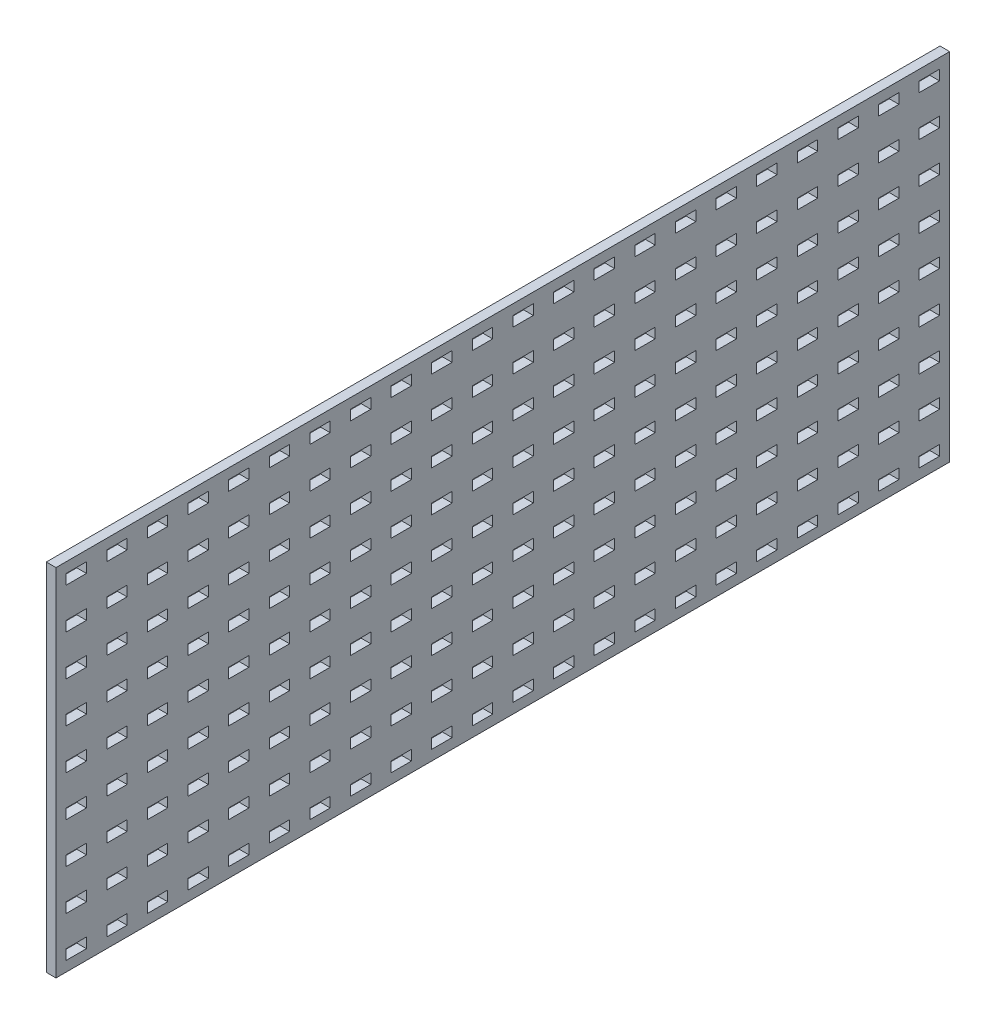
from build123d import *

# Parameters (mm, degrees)
SKETCH1_W           = 558.8
SKETCH1_H           = 222.25
BOSS_EXTRUDE1_DEPTH = 3.0226
SKETCH2_W           = 12.7
SKETCH2_H           = 6.35
CUT_EXTRUDE1_DEPTH  = 301.748516319


with BuildPart() as part:
    # Sketch1 → Boss-Extrude1 (new, symmetric)
    with BuildSketch(Plane(origin=(0, 0, 0), x_dir=(0, 0, -1), z_dir=(1, 0, 0))):
        Rectangle(SKETCH1_W, SKETCH1_H)
    extrude(amount=BOSS_EXTRUDE1_DEPTH, both=True)

    # Sketch2 → Cut-Extrude1 (cut, through all)
    with BuildSketch(Plane(origin=(3.0226, 0, 0), x_dir=(0, 0, -1), z_dir=(1, 0, 0))):
        with Locations((266.7, -101.6)):
            Rectangle(SKETCH2_W, SKETCH2_H)
        with Locations((241.3, -101.6)):
            Rectangle(SKETCH2_W, SKETCH2_H)
        with Locations((215.9, -101.6)):
            Rectangle(SKETCH2_W, SKETCH2_H)
        with Locations((190.5, -101.6)):
            Rectangle(SKETCH2_W, SKETCH2_H)
        with Locations((165.1, -101.6)):
            Rectangle(SKETCH2_W, SKETCH2_H)
        with Locations((139.7, -101.6)):
            Rectangle(SKETCH2_W, SKETCH2_H)
        with Locations((114.3, -101.6)):
            Rectangle(SKETCH2_W, SKETCH2_H)
        with Locations((88.9, -101.6)):
            Rectangle(SKETCH2_W, SKETCH2_H)
        with Locations((63.5, -101.6)):
            Rectangle(SKETCH2_W, SKETCH2_H)
        with Locations((38.1, -101.6)):
            Rectangle(SKETCH2_W, SKETCH2_H)
        with Locations((12.7, -101.6)):
            Rectangle(SKETCH2_W, SKETCH2_H)
        with Locations((-12.7, -101.6)):
            Rectangle(SKETCH2_W, SKETCH2_H)
        with Locations((-38.1, -101.6)):
            Rectangle(SKETCH2_W, SKETCH2_H)
        with Locations((-63.5, -101.6)):
            Rectangle(SKETCH2_W, SKETCH2_H)
        with Locations((-88.9, -101.6)):
            Rectangle(SKETCH2_W, SKETCH2_H)
        with Locations((-114.3, -101.6)):
            Rectangle(SKETCH2_W, SKETCH2_H)
        with Locations((-139.7, -101.6)):
            Rectangle(SKETCH2_W, SKETCH2_H)
        with Locations((-165.1, -101.6)):
            Rectangle(SKETCH2_W, SKETCH2_H)
        with Locations((-190.5, -101.6)):
            Rectangle(SKETCH2_W, SKETCH2_H)
        with Locations((-215.9, -101.6)):
            Rectangle(SKETCH2_W, SKETCH2_H)
        with Locations((-241.3, -101.6)):
            Rectangle(SKETCH2_W, SKETCH2_H)
        with Locations((-266.7, -101.6)):
            Rectangle(SKETCH2_W, SKETCH2_H)
        with Locations((241.3, -76.2)):
            Rectangle(SKETCH2_W, SKETCH2_H)
        with Locations((215.9, -76.2)):
            Rectangle(SKETCH2_W, SKETCH2_H)
        with Locations((190.5, -76.2)):
            Rectangle(SKETCH2_W, SKETCH2_H)
        with Locations((165.1, -76.2)):
            Rectangle(SKETCH2_W, SKETCH2_H)
        with Locations((139.7, -76.2)):
            Rectangle(SKETCH2_W, SKETCH2_H)
        with Locations((114.3, -76.2)):
            Rectangle(SKETCH2_W, SKETCH2_H)
        with Locations((88.9, -76.2)):
            Rectangle(SKETCH2_W, SKETCH2_H)
        with Locations((63.5, -76.2)):
            Rectangle(SKETCH2_W, SKETCH2_H)
        with Locations((38.1, -76.2)):
            Rectangle(SKETCH2_W, SKETCH2_H)
        with Locations((12.7, -76.2)):
            Rectangle(SKETCH2_W, SKETCH2_H)
        with Locations((-12.7, -76.2)):
            Rectangle(SKETCH2_W, SKETCH2_H)
        with Locations((-38.1, -76.2)):
            Rectangle(SKETCH2_W, SKETCH2_H)
        with Locations((-63.5, -76.2)):
            Rectangle(SKETCH2_W, SKETCH2_H)
        with Locations((-88.9, -76.2)):
            Rectangle(SKETCH2_W, SKETCH2_H)
        with Locations((-114.3, -76.2)):
            Rectangle(SKETCH2_W, SKETCH2_H)
        with Locations((-139.7, -76.2)):
            Rectangle(SKETCH2_W, SKETCH2_H)
        with Locations((-165.1, -76.2)):
            Rectangle(SKETCH2_W, SKETCH2_H)
        with Locations((-190.5, -76.2)):
            Rectangle(SKETCH2_W, SKETCH2_H)
        with Locations((-215.9, -76.2)):
            Rectangle(SKETCH2_W, SKETCH2_H)
        with Locations((-241.3, -76.2)):
            Rectangle(SKETCH2_W, SKETCH2_H)
        with Locations((-266.7, -76.2)):
            Rectangle(SKETCH2_W, SKETCH2_H)
        with Locations((241.3, -50.8)):
            Rectangle(SKETCH2_W, SKETCH2_H)
        with Locations((215.9, -50.8)):
            Rectangle(SKETCH2_W, SKETCH2_H)
        with Locations((190.5, -50.8)):
            Rectangle(SKETCH2_W, SKETCH2_H)
        with Locations((165.1, -50.8)):
            Rectangle(SKETCH2_W, SKETCH2_H)
        with Locations((139.7, -50.8)):
            Rectangle(SKETCH2_W, SKETCH2_H)
        with Locations((114.3, -50.8)):
            Rectangle(SKETCH2_W, SKETCH2_H)
        with Locations((88.9, -50.8)):
            Rectangle(SKETCH2_W, SKETCH2_H)
        with Locations((63.5, -50.8)):
            Rectangle(SKETCH2_W, SKETCH2_H)
        with Locations((38.1, -50.8)):
            Rectangle(SKETCH2_W, SKETCH2_H)
        with Locations((12.7, -50.8)):
            Rectangle(SKETCH2_W, SKETCH2_H)
        with Locations((-12.7, -50.8)):
            Rectangle(SKETCH2_W, SKETCH2_H)
        with Locations((-38.1, -50.8)):
            Rectangle(SKETCH2_W, SKETCH2_H)
        with Locations((-63.5, -50.8)):
            Rectangle(SKETCH2_W, SKETCH2_H)
        with Locations((-88.9, -50.8)):
            Rectangle(SKETCH2_W, SKETCH2_H)
        with Locations((-114.3, -50.8)):
            Rectangle(SKETCH2_W, SKETCH2_H)
        with Locations((-139.7, -50.8)):
            Rectangle(SKETCH2_W, SKETCH2_H)
        with Locations((-165.1, -50.8)):
            Rectangle(SKETCH2_W, SKETCH2_H)
        with Locations((-190.5, -50.8)):
            Rectangle(SKETCH2_W, SKETCH2_H)
        with Locations((-215.9, -50.8)):
            Rectangle(SKETCH2_W, SKETCH2_H)
        with Locations((-241.3, -50.8)):
            Rectangle(SKETCH2_W, SKETCH2_H)
        with Locations((-266.7, -50.8)):
            Rectangle(SKETCH2_W, SKETCH2_H)
        with Locations((241.3, -25.4)):
            Rectangle(SKETCH2_W, SKETCH2_H)
        with Locations((215.9, -25.4)):
            Rectangle(SKETCH2_W, SKETCH2_H)
        with Locations((190.5, -25.4)):
            Rectangle(SKETCH2_W, SKETCH2_H)
        with Locations((165.1, -25.4)):
            Rectangle(SKETCH2_W, SKETCH2_H)
        with Locations((139.7, -25.4)):
            Rectangle(SKETCH2_W, SKETCH2_H)
        with Locations((114.3, -25.4)):
            Rectangle(SKETCH2_W, SKETCH2_H)
        with Locations((88.9, -25.4)):
            Rectangle(SKETCH2_W, SKETCH2_H)
        with Locations((63.5, -25.4)):
            Rectangle(SKETCH2_W, SKETCH2_H)
        with Locations((38.1, -25.4)):
            Rectangle(SKETCH2_W, SKETCH2_H)
        with Locations((12.7, -25.4)):
            Rectangle(SKETCH2_W, SKETCH2_H)
        with Locations((-12.7, -25.4)):
            Rectangle(SKETCH2_W, SKETCH2_H)
        with Locations((-38.1, -25.4)):
            Rectangle(SKETCH2_W, SKETCH2_H)
        with Locations((-63.5, -25.4)):
            Rectangle(SKETCH2_W, SKETCH2_H)
        with Locations((-88.9, -25.4)):
            Rectangle(SKETCH2_W, SKETCH2_H)
        with Locations((-114.3, -25.4)):
            Rectangle(SKETCH2_W, SKETCH2_H)
        with Locations((-139.7, -25.4)):
            Rectangle(SKETCH2_W, SKETCH2_H)
        with Locations((-165.1, -25.4)):
            Rectangle(SKETCH2_W, SKETCH2_H)
        with Locations((-190.5, -25.4)):
            Rectangle(SKETCH2_W, SKETCH2_H)
        with Locations((-215.9, -25.4)):
            Rectangle(SKETCH2_W, SKETCH2_H)
        with Locations((-241.3, -25.4)):
            Rectangle(SKETCH2_W, SKETCH2_H)
        with Locations((-266.7, -25.4)):
            Rectangle(SKETCH2_W, SKETCH2_H)
        with Locations((241.3, 0)):
            Rectangle(SKETCH2_W, SKETCH2_H)
        with Locations((215.9, 0)):
            Rectangle(SKETCH2_W, SKETCH2_H)
        with Locations((190.5, 0)):
            Rectangle(SKETCH2_W, SKETCH2_H)
        with Locations((165.1, 0)):
            Rectangle(SKETCH2_W, SKETCH2_H)
        with Locations((139.7, 0)):
            Rectangle(SKETCH2_W, SKETCH2_H)
        with Locations((114.3, 0)):
            Rectangle(SKETCH2_W, SKETCH2_H)
        with Locations((88.9, 0)):
            Rectangle(SKETCH2_W, SKETCH2_H)
        with Locations((63.5, 0)):
            Rectangle(SKETCH2_W, SKETCH2_H)
        with Locations((38.1, 0)):
            Rectangle(SKETCH2_W, SKETCH2_H)
        with Locations((12.7, 0)):
            Rectangle(SKETCH2_W, SKETCH2_H)
        with Locations((-12.7, 0)):
            Rectangle(SKETCH2_W, SKETCH2_H)
        with Locations((-38.1, 0)):
            Rectangle(SKETCH2_W, SKETCH2_H)
        with Locations((-63.5, 0)):
            Rectangle(SKETCH2_W, SKETCH2_H)
        with Locations((-88.9, 0)):
            Rectangle(SKETCH2_W, SKETCH2_H)
        with Locations((-114.3, 0)):
            Rectangle(SKETCH2_W, SKETCH2_H)
        with Locations((-139.7, 0)):
            Rectangle(SKETCH2_W, SKETCH2_H)
        with Locations((-165.1, 0)):
            Rectangle(SKETCH2_W, SKETCH2_H)
        with Locations((-190.5, 0)):
            Rectangle(SKETCH2_W, SKETCH2_H)
        with Locations((-215.9, 0)):
            Rectangle(SKETCH2_W, SKETCH2_H)
        with Locations((-241.3, 0)):
            Rectangle(SKETCH2_W, SKETCH2_H)
        with Locations((-266.7, 0)):
            Rectangle(SKETCH2_W, SKETCH2_H)
        with Locations((241.3, 25.4)):
            Rectangle(SKETCH2_W, SKETCH2_H)
        with Locations((215.9, 25.4)):
            Rectangle(SKETCH2_W, SKETCH2_H)
        with Locations((190.5, 25.4)):
            Rectangle(SKETCH2_W, SKETCH2_H)
        with Locations((165.1, 25.4)):
            Rectangle(SKETCH2_W, SKETCH2_H)
        with Locations((139.7, 25.4)):
            Rectangle(SKETCH2_W, SKETCH2_H)
        with Locations((114.3, 25.4)):
            Rectangle(SKETCH2_W, SKETCH2_H)
        with Locations((88.9, 25.4)):
            Rectangle(SKETCH2_W, SKETCH2_H)
        with Locations((63.5, 25.4)):
            Rectangle(SKETCH2_W, SKETCH2_H)
        with Locations((38.1, 25.4)):
            Rectangle(SKETCH2_W, SKETCH2_H)
        with Locations((12.7, 25.4)):
            Rectangle(SKETCH2_W, SKETCH2_H)
        with Locations((-12.7, 25.4)):
            Rectangle(SKETCH2_W, SKETCH2_H)
        with Locations((-38.1, 25.4)):
            Rectangle(SKETCH2_W, SKETCH2_H)
        with Locations((-63.5, 25.4)):
            Rectangle(SKETCH2_W, SKETCH2_H)
        with Locations((-88.9, 25.4)):
            Rectangle(SKETCH2_W, SKETCH2_H)
        with Locations((-114.3, 25.4)):
            Rectangle(SKETCH2_W, SKETCH2_H)
        with Locations((-139.7, 25.4)):
            Rectangle(SKETCH2_W, SKETCH2_H)
        with Locations((-165.1, 25.4)):
            Rectangle(SKETCH2_W, SKETCH2_H)
        with Locations((-190.5, 25.4)):
            Rectangle(SKETCH2_W, SKETCH2_H)
        with Locations((-215.9, 25.4)):
            Rectangle(SKETCH2_W, SKETCH2_H)
        with Locations((-241.3, 25.4)):
            Rectangle(SKETCH2_W, SKETCH2_H)
        with Locations((-266.7, 25.4)):
            Rectangle(SKETCH2_W, SKETCH2_H)
        with Locations((241.3, 50.8)):
            Rectangle(SKETCH2_W, SKETCH2_H)
        with Locations((215.9, 50.8)):
            Rectangle(SKETCH2_W, SKETCH2_H)
        with Locations((190.5, 50.8)):
            Rectangle(SKETCH2_W, SKETCH2_H)
        with Locations((165.1, 50.8)):
            Rectangle(SKETCH2_W, SKETCH2_H)
        with Locations((139.7, 50.8)):
            Rectangle(SKETCH2_W, SKETCH2_H)
        with Locations((114.3, 50.8)):
            Rectangle(SKETCH2_W, SKETCH2_H)
        with Locations((88.9, 50.8)):
            Rectangle(SKETCH2_W, SKETCH2_H)
        with Locations((63.5, 50.8)):
            Rectangle(SKETCH2_W, SKETCH2_H)
        with Locations((38.1, 50.8)):
            Rectangle(SKETCH2_W, SKETCH2_H)
        with Locations((12.7, 50.8)):
            Rectangle(SKETCH2_W, SKETCH2_H)
        with Locations((-12.7, 50.8)):
            Rectangle(SKETCH2_W, SKETCH2_H)
        with Locations((-38.1, 50.8)):
            Rectangle(SKETCH2_W, SKETCH2_H)
        with Locations((-63.5, 50.8)):
            Rectangle(SKETCH2_W, SKETCH2_H)
        with Locations((-88.9, 50.8)):
            Rectangle(SKETCH2_W, SKETCH2_H)
        with Locations((-114.3, 50.8)):
            Rectangle(SKETCH2_W, SKETCH2_H)
        with Locations((-139.7, 50.8)):
            Rectangle(SKETCH2_W, SKETCH2_H)
        with Locations((-165.1, 50.8)):
            Rectangle(SKETCH2_W, SKETCH2_H)
        with Locations((-190.5, 50.8)):
            Rectangle(SKETCH2_W, SKETCH2_H)
        with Locations((-215.9, 50.8)):
            Rectangle(SKETCH2_W, SKETCH2_H)
        with Locations((-241.3, 50.8)):
            Rectangle(SKETCH2_W, SKETCH2_H)
        with Locations((-266.7, 50.8)):
            Rectangle(SKETCH2_W, SKETCH2_H)
        with Locations((241.3, 76.2)):
            Rectangle(SKETCH2_W, SKETCH2_H)
        with Locations((215.9, 76.2)):
            Rectangle(SKETCH2_W, SKETCH2_H)
        with Locations((190.5, 76.2)):
            Rectangle(SKETCH2_W, SKETCH2_H)
        with Locations((165.1, 76.2)):
            Rectangle(SKETCH2_W, SKETCH2_H)
        with Locations((139.7, 76.2)):
            Rectangle(SKETCH2_W, SKETCH2_H)
        with Locations((114.3, 76.2)):
            Rectangle(SKETCH2_W, SKETCH2_H)
        with Locations((88.9, 76.2)):
            Rectangle(SKETCH2_W, SKETCH2_H)
        with Locations((63.5, 76.2)):
            Rectangle(SKETCH2_W, SKETCH2_H)
        with Locations((38.1, 76.2)):
            Rectangle(SKETCH2_W, SKETCH2_H)
        with Locations((12.7, 76.2)):
            Rectangle(SKETCH2_W, SKETCH2_H)
        with Locations((-12.7, 76.2)):
            Rectangle(SKETCH2_W, SKETCH2_H)
        with Locations((-38.1, 76.2)):
            Rectangle(SKETCH2_W, SKETCH2_H)
        with Locations((-63.5, 76.2)):
            Rectangle(SKETCH2_W, SKETCH2_H)
        with Locations((-88.9, 76.2)):
            Rectangle(SKETCH2_W, SKETCH2_H)
        with Locations((-114.3, 76.2)):
            Rectangle(SKETCH2_W, SKETCH2_H)
        with Locations((-139.7, 76.2)):
            Rectangle(SKETCH2_W, SKETCH2_H)
        with Locations((-165.1, 76.2)):
            Rectangle(SKETCH2_W, SKETCH2_H)
        with Locations((-190.5, 76.2)):
            Rectangle(SKETCH2_W, SKETCH2_H)
        with Locations((-215.9, 76.2)):
            Rectangle(SKETCH2_W, SKETCH2_H)
        with Locations((-241.3, 76.2)):
            Rectangle(SKETCH2_W, SKETCH2_H)
        with Locations((-266.7, 76.2)):
            Rectangle(SKETCH2_W, SKETCH2_H)
        with Locations((241.3, 101.6)):
            Rectangle(SKETCH2_W, SKETCH2_H)
        with Locations((215.9, 101.6)):
            Rectangle(SKETCH2_W, SKETCH2_H)
        with Locations((190.5, 101.6)):
            Rectangle(SKETCH2_W, SKETCH2_H)
        with Locations((165.1, 101.6)):
            Rectangle(SKETCH2_W, SKETCH2_H)
        with Locations((139.7, 101.6)):
            Rectangle(SKETCH2_W, SKETCH2_H)
        with Locations((114.3, 101.6)):
            Rectangle(SKETCH2_W, SKETCH2_H)
        with Locations((88.9, 101.6)):
            Rectangle(SKETCH2_W, SKETCH2_H)
        with Locations((63.5, 101.6)):
            Rectangle(SKETCH2_W, SKETCH2_H)
        with Locations((38.1, 101.6)):
            Rectangle(SKETCH2_W, SKETCH2_H)
        with Locations((12.7, 101.6)):
            Rectangle(SKETCH2_W, SKETCH2_H)
        with Locations((-12.7, 101.6)):
            Rectangle(SKETCH2_W, SKETCH2_H)
        with Locations((-38.1, 101.6)):
            Rectangle(SKETCH2_W, SKETCH2_H)
        with Locations((-63.5, 101.6)):
            Rectangle(SKETCH2_W, SKETCH2_H)
        with Locations((-88.9, 101.6)):
            Rectangle(SKETCH2_W, SKETCH2_H)
        with Locations((-114.3, 101.6)):
            Rectangle(SKETCH2_W, SKETCH2_H)
        with Locations((-139.7, 101.6)):
            Rectangle(SKETCH2_W, SKETCH2_H)
        with Locations((-165.1, 101.6)):
            Rectangle(SKETCH2_W, SKETCH2_H)
        with Locations((-190.5, 101.6)):
            Rectangle(SKETCH2_W, SKETCH2_H)
        with Locations((-215.9, 101.6)):
            Rectangle(SKETCH2_W, SKETCH2_H)
        with Locations((-241.3, 101.6)):
            Rectangle(SKETCH2_W, SKETCH2_H)
        with Locations((-266.7, 101.6)):
            Rectangle(SKETCH2_W, SKETCH2_H)
        with Locations((241.3, 127)):
            Rectangle(SKETCH2_W, SKETCH2_H)
        with Locations((215.9, 127)):
            Rectangle(SKETCH2_W, SKETCH2_H)
        with Locations((190.5, 127)):
            Rectangle(SKETCH2_W, SKETCH2_H)
        with Locations((165.1, 127)):
            Rectangle(SKETCH2_W, SKETCH2_H)
        with Locations((139.7, 127)):
            Rectangle(SKETCH2_W, SKETCH2_H)
        with Locations((114.3, 127)):
            Rectangle(SKETCH2_W, SKETCH2_H)
        with Locations((88.9, 127)):
            Rectangle(SKETCH2_W, SKETCH2_H)
        with Locations((63.5, 127)):
            Rectangle(SKETCH2_W, SKETCH2_H)
        with Locations((38.1, 127)):
            Rectangle(SKETCH2_W, SKETCH2_H)
        with Locations((12.7, 127)):
            Rectangle(SKETCH2_W, SKETCH2_H)
        with Locations((-12.7, 127)):
            Rectangle(SKETCH2_W, SKETCH2_H)
        with Locations((-38.1, 127)):
            Rectangle(SKETCH2_W, SKETCH2_H)
        with Locations((-63.5, 127)):
            Rectangle(SKETCH2_W, SKETCH2_H)
        with Locations((-88.9, 127)):
            Rectangle(SKETCH2_W, SKETCH2_H)
        with Locations((-114.3, 127)):
            Rectangle(SKETCH2_W, SKETCH2_H)
        with Locations((-139.7, 127)):
            Rectangle(SKETCH2_W, SKETCH2_H)
        with Locations((-165.1, 127)):
            Rectangle(SKETCH2_W, SKETCH2_H)
        with Locations((-190.5, 127)):
            Rectangle(SKETCH2_W, SKETCH2_H)
        with Locations((-215.9, 127)):
            Rectangle(SKETCH2_W, SKETCH2_H)
        with Locations((-241.3, 127)):
            Rectangle(SKETCH2_W, SKETCH2_H)
        with Locations((-266.7, 127)):
            Rectangle(SKETCH2_W, SKETCH2_H)
        with Locations((266.7, -76.2)):
            Rectangle(SKETCH2_W, SKETCH2_H)
        with Locations((266.7, -50.8)):
            Rectangle(SKETCH2_W, SKETCH2_H)
        with Locations((266.7, -25.4)):
            Rectangle(SKETCH2_W, SKETCH2_H)
        with Locations((266.7, 0)):
            Rectangle(SKETCH2_W, SKETCH2_H)
        with Locations((266.7, 25.4)):
            Rectangle(SKETCH2_W, SKETCH2_H)
        with Locations((266.7, 50.8)):
            Rectangle(SKETCH2_W, SKETCH2_H)
        with Locations((266.7, 76.2)):
            Rectangle(SKETCH2_W, SKETCH2_H)
        with Locations((266.7, 101.6)):
            Rectangle(SKETCH2_W, SKETCH2_H)
        with Locations((266.7, 127)):
            Rectangle(SKETCH2_W, SKETCH2_H)
    extrude(amount=-CUT_EXTRUDE1_DEPTH, mode=Mode.SUBTRACT)


solid = part.part
